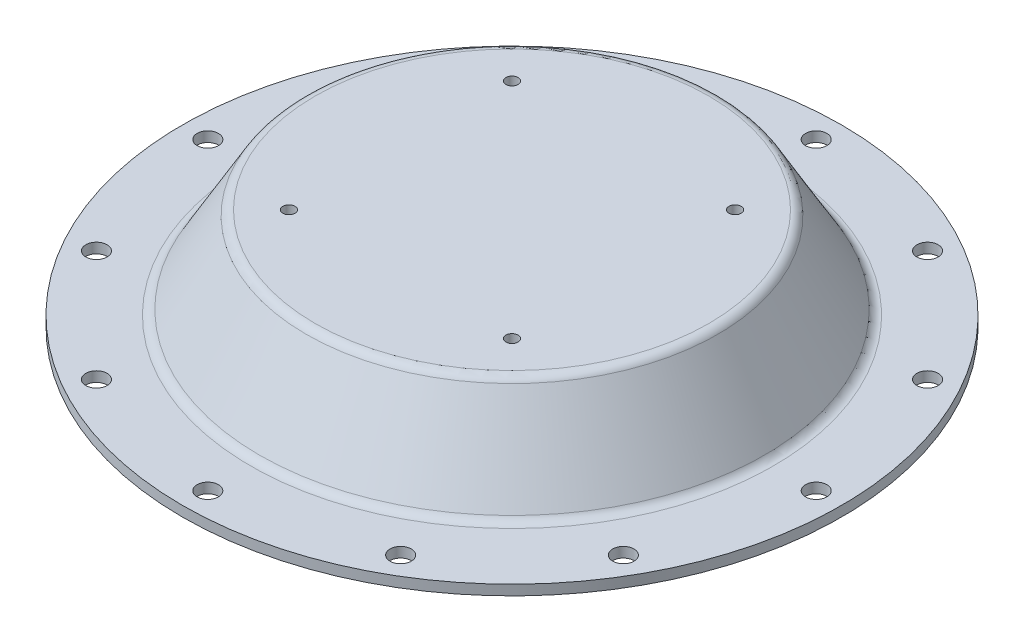
from build123d import *

# Parameters (mm, degrees)
SKETCH_1_R               = 200
EXTRUDE_1_DEPTH          = 100
EXTRUDE_1_DRAFT          = 30
SKETCH_4_R               = 325
EXTRUDE_2_DEPTH          = 10
FILLET_1_R               = 10
HOLE_WIZARD_M14_1_D      = 12
HOLE_WIZARD_1_D          = 21
PATTERN_CIRCULAR_1_COUNT = 12


# Read off the part's stored shape, not the designer's step: 抽壳1
with BuildPart() as part:
    # 草图1 → 凸台-拉伸1 (with draft: the straight prism first)
    with BuildSketch(Plane(origin=(0, 0, 0), x_dir=(1, 0, 0), z_dir=(0, 1, 0))):
        Circle(SKETCH_1_R)
    extrude(amount=-EXTRUDE_1_DEPTH)
    # 凸台-拉伸1: the draft: its side faces are tilted about the plane it starts from
    extrude_1_sides = [part.faces().sort_by_distance(p)[0] for p in [
        (-200, -50, 0),
    ]]
    draft(extrude_1_sides, Plane(origin=(0, 0, 0), x_dir=(1, 0, 0), z_dir=(0, 1, 0)), EXTRUDE_1_DRAFT)

    # 草图4 → 凸台-拉伸2 (add)
    with BuildSketch(Plane.XZ.offset(100)):
        with Locations(Location((0, 0, 0), (0, 0, 270))):
            Circle(SKETCH_4_R)
    extrude(amount=-EXTRUDE_2_DEPTH)

    # 抽壳1 outline → 抽壳1 (revolve, cut)
    with BuildSketch(Plane.XY):
        Polygon((246.188021535, -100), (194.226497308, -10), (0, -10), (0, -100), align=None)
    revolve(axis=Axis((0, 0, 0), (0, 1, 0)), mode=Mode.SUBTRACT)

    # 圆角1
    fillet_1_edges = [part.edges().sort_by_distance(p)[0] for p in [
        (-246.188021535, -100, 0),
        (-194.226497308, -10, 0),
        (-200, 0, 0),
        (-251.961524227, -90, 0),
    ]]
    fillet(fillet_1_edges, radius=FILLET_1_R)

    # M14 螺纹孔1 (through all)
    with Locations(Plane(origin=(0, -100, 0), x_dir=(-1, 0, 0), z_dir=(0, -1, 0))):
        with Locations((-110, -110), (-110, 110), (110, -110), (110, 110)):
            Hole(HOLE_WIZARD_M14_1_D / 2)

    # 孔1 (through all)
    with Locations(Plane(origin=(0, -90, 0), x_dir=(1, 0, 0), z_dir=(0, 1, 0))):
        with Locations((300, 0)):
            hole_wizard_1 = Hole(HOLE_WIZARD_1_D / 2)

    # 阵列(圆周)1: 孔1 ×12 about axis
    pattern_circular_1_axis = Axis((0, 0, 0), (0, 1, 0))
    for i in range(1, PATTERN_CIRCULAR_1_COUNT):
        add(hole_wizard_1.rotate(pattern_circular_1_axis, i * 360 / PATTERN_CIRCULAR_1_COUNT), mode=Mode.SUBTRACT)


solid = part.part
